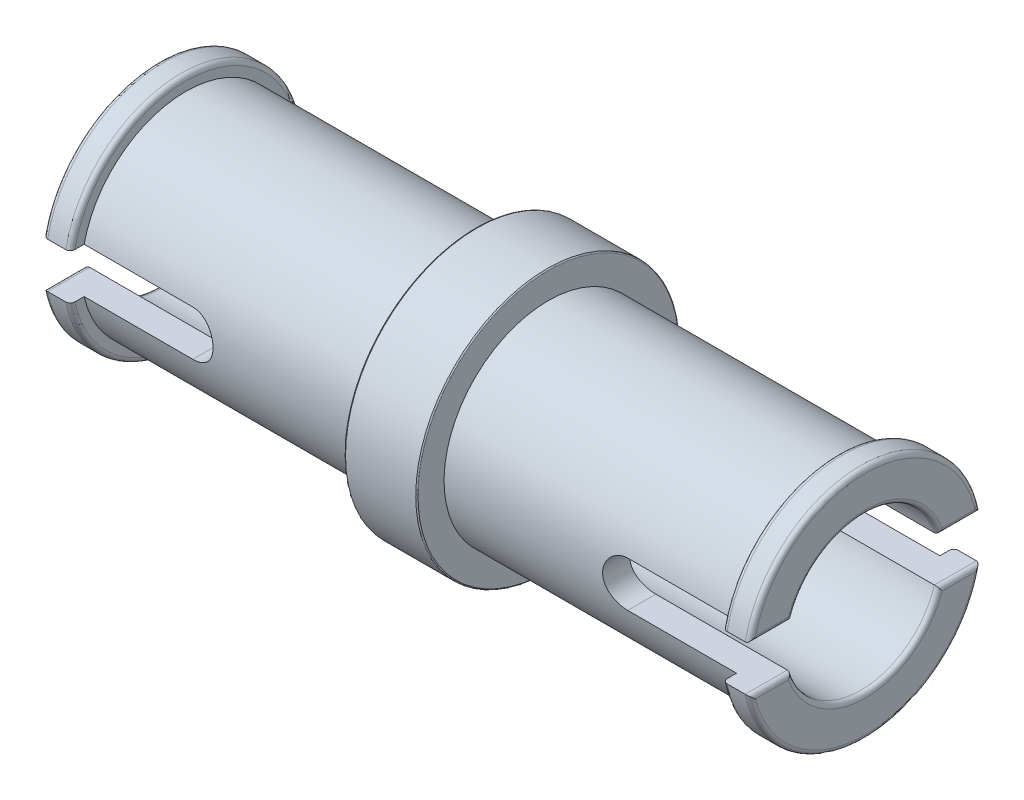
from build123d import *

# Parameters (mm, degrees)
CUT_EXTRUDE1_DEPTH      = 9.812491135
CUT_EXTRUDE1_DEPTH_BACK = 9.812491135
FILLET3_R               = 0.1
FILLET5_R               = 0.025
FILLET7_R               = 0.1


with BuildPart() as part:
    # Sketch1 → Revolve1 (revolve)
    with BuildSketch(Plane.XY):
        Polygon((0, 1.7), (0, 2.9), (-0.8, 2.9), (-0.8, 2.3), (-7.2, 2.3), (-7.2, 2.6), (-7.8, 2.6), (-7.8, 1.7), align=None)
    revolve(axis=Axis((0, 0, 0), (-1, 0, 0)))

    # Sketch2 → Cut-Extrude1 (cut, two sides: drawn at the far end of the back side and taken through both)
    with BuildSketch(Plane.XY.offset(-CUT_EXTRUDE1_DEPTH_BACK)):
        with BuildLine():
            Line((-7.8, 0.5), (-4.8, 0.5))
            ThreePointArc((-4.8, 0.5), (-4.3, 0), (-4.8, -0.5))
            Line((-4.8, -0.5), (-7.8, -0.5))
            Line((-7.8, -0.5), (-7.8, 0.5))
        make_face()
    extrude(amount=CUT_EXTRUDE1_DEPTH + CUT_EXTRUDE1_DEPTH_BACK, mode=Mode.SUBTRACT)

    # Fillet3
    fillet3_edges = [part.edges().sort_by_distance(p)[0] for p in [
        (-7.8, -1.7, 0),
        (-7.8, 1.367479433, 1.009950494),
        (-7.8, -2.6, 0),
        (-7.8, 2.6, 0),
        (-7.8, -0.5, -2.088138923),
        (-7.8, 0.5, 2.088138923),
        (-7.8, -0.5, 2.088138923),
        (-7.8, 0.5, -2.088138923),
    ]]
    fillet(fillet3_edges, radius=FILLET3_R - 0.0001)  # a hair under: the kernel refuses the full size

    # Fillet5
    fillet5_edges = [part.edges().sort_by_distance(p)[0] for p in [
        (-0.8, -2.9, 0),
    ]]
    fillet(fillet5_edges, radius=FILLET5_R)

    # Fillet7
    fillet7_edges = [part.edges().sort_by_distance(p)[0] for p in [
        (-7.2, -2.6, 0),
        (-7.2, 2.6, 0),
    ]]
    fillet(fillet7_edges, radius=FILLET7_R)

    # Mirror1: part across plane


with BuildPart() as part_1:
    add(part.part)
    add(part.part.mirror(Plane(origin=(0, 1.7, 0), x_dir=(0, 0, 1), z_dir=(1, 0, 0))))


solid = part_1.part
